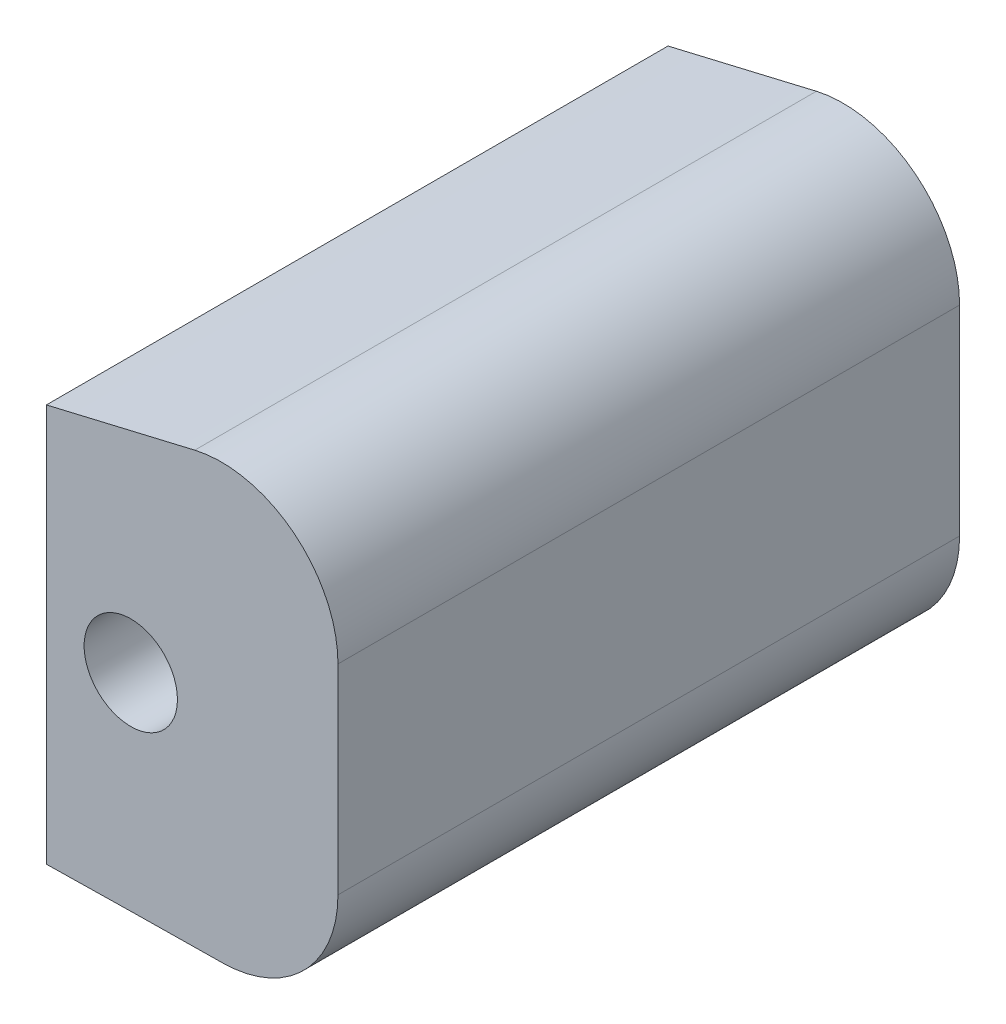
from build123d import *

# Parameters (mm, degrees)
SKETCH1_R           = 2.127
SKETCH1_R_2         = 2.032
BOSS_EXTRUDE1_DEPTH = 27.0764
SKETCH2_W           = 88.723085019
SKETCH2_H           = 32.948386637
CUT_EXTRUDE1_DEPTH  = 27.0764


with BuildPart() as part:
    # Sketch1 → Boss-Extrude1 (new body)
    with BuildSketch(Plane.XY):
        with BuildLine():
            Line((42.918297493, -0.447743106), (42.918297493, 8.263094686))
            ThreePointArc((42.918297493, 8.263094686), (40.994864427, 12.243356636), (36.681098599, 13.209536914))
            add(Edge.make_bspline(
                [(36.681098599, 13.209536914), (19.829765645, 9.267240013), (-2.073589943, 3.844068304), (-31.096466219, -5.545914493), (-39.316765165, -8.806631661), (-49.515556323, -12.495660485), (-45.77248955, -12.10685039)],
                knots=[0.118068853, 0.118068853, 0.118068853, 0.118068853, 0.630725311, 0.824213609, 0.940085477, 1, 1, 1, 1], degree=3))
            add(Edge.make_bspline(
                [(-45.77248955, -12.10685039), (-41.337443699, -10.999265489), (-33.831609628, -10.530043097), (-20.483498257, -8.707547198), (-8.873433654, -8.01917435), (11.524588595, -6.028171323), (26.067321973, -5.659784939), (37.895141959, -5.527425055)],
                knots=[0, 0, 0, 0, 0.144322392, 0.237947652, 0.42712275, 0.512831912, 0.887817721, 0.887817721, 0.887817721, 0.887817721], degree=3))
            ThreePointArc((37.895141959, -5.527425055), (41.450441586, -4.019691462), (42.918297493, -0.447743106))
        make_face()
        with Locations((-19.10248955, -6.01085039)):
            Circle(SKETCH1_R, mode=Mode.SUBTRACT)
        with Locations((12.64751045, 4.40314961)):
            Circle(SKETCH1_R, mode=Mode.SUBTRACT)
        with Locations((33.89346968, 3.421717851)):
            Circle(SKETCH1_R_2, mode=Mode.SUBTRACT)
    extrude(amount=BOSS_EXTRUDE1_DEPTH)

    # Sketch2 → Cut-Extrude1 (cut)
    with BuildSketch(Plane.XY.offset(27.0764)):
        with Locations((-14.143245016, -2.355433399)):
            Rectangle(SKETCH2_W, SKETCH2_H)
    extrude(amount=-CUT_EXTRUDE1_DEPTH, mode=Mode.SUBTRACT)


solid = part.part
